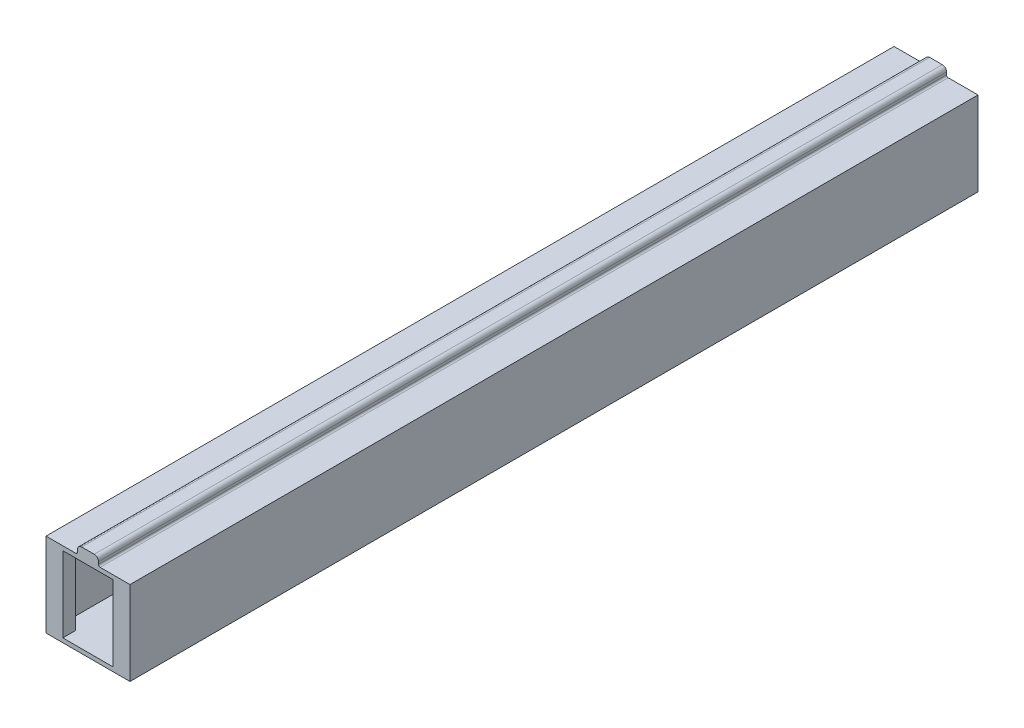
from build123d import *

# Parameters (mm, degrees)
SKETCH1_R           = 1.778
SKETCH1_R_2         = 6.35
BOSS_EXTRUDE1_DEPTH = 2.54
SKETCH2_W           = 22.86
SKETCH2_H           = 22.86
BOSS_EXTRUDE2_DEPTH = 254
SKETCH3_W           = 3.81
SKETCH3_H           = 22.86
BOSS_EXTRUDE3_DEPTH = 3.81
SKETCH4_W           = 5.08
SKETCH4_H           = 22.86
BOSS_EXTRUDE4_DEPTH = 3.81
FILLET1_R           = 1.27
FILLET2_R           = 0.508


with BuildPart() as part:
    # Sketch1 → Boss-Extrude1 (new body)
    with BuildSketch(Plane.XY):
        Polygon((-12.7, -12.7), (12.7, -12.7), (12.7, 12.7), (3.175, 12.7), (3.175, 15.24), (-3.175, 15.24), (-3.175, 12.7), (-12.7, 12.7), align=None)
        with Locations((0, -9.525)):
            Circle(SKETCH1_R, mode=Mode.SUBTRACT)
        with Locations((-8.248891971, 4.7625)):
            Circle(SKETCH1_R, mode=Mode.SUBTRACT)
        with Locations((8.248891971, 4.7625)):
            Circle(SKETCH1_R, mode=Mode.SUBTRACT)
        Circle(SKETCH1_R_2, mode=Mode.SUBTRACT)
    extrude(amount=BOSS_EXTRUDE1_DEPTH)

    # Sketch2 → Boss-Extrude2 (add)
    with BuildSketch(Plane.XY.offset(2.54)):
        Polygon((-12.7, -12.7), (12.7, -12.7), (12.7, 12.7), (3.175, 12.7), (3.175, 15.24), (-3.175, 15.24), (-3.175, 12.7), (-12.7, 12.7), align=None)
        Rectangle(SKETCH2_W, SKETCH2_H, mode=Mode.SUBTRACT)
    extrude(amount=BOSS_EXTRUDE2_DEPTH)

    # Sketch3 → Boss-Extrude3 (add)
    with BuildSketch(Plane(origin=(-11.43, 0, 0), x_dir=(0, 0, -1), z_dir=(1, 0, 0))):
        with Locations((-254.635, 0)):
            Rectangle(SKETCH3_W, SKETCH3_H)
    extrude(amount=BOSS_EXTRUDE3_DEPTH)

    # Sketch4 → Boss-Extrude4 (add)
    with BuildSketch(Plane.ZY.offset(-11.43)):
        with Locations((254, 0)):
            Rectangle(SKETCH4_W, SKETCH4_H)
    extrude(amount=BOSS_EXTRUDE4_DEPTH)

    # Fillet1
    fillet1_edges = [part.edges().sort_by_distance(p)[0] for p in [
        (3.175, 15.24, 128.27),
        (-3.175, 15.24, 128.27),
    ]]
    fillet(fillet1_edges, radius=FILLET1_R)

    # Fillet2
    fillet2_edges = [part.edges().sort_by_distance(p)[0] for p in [
        (3.175, 12.7, 128.27),
        (-3.175, 12.7, 128.27),
    ]]
    fillet(fillet2_edges, radius=FILLET2_R)


solid = part.part
